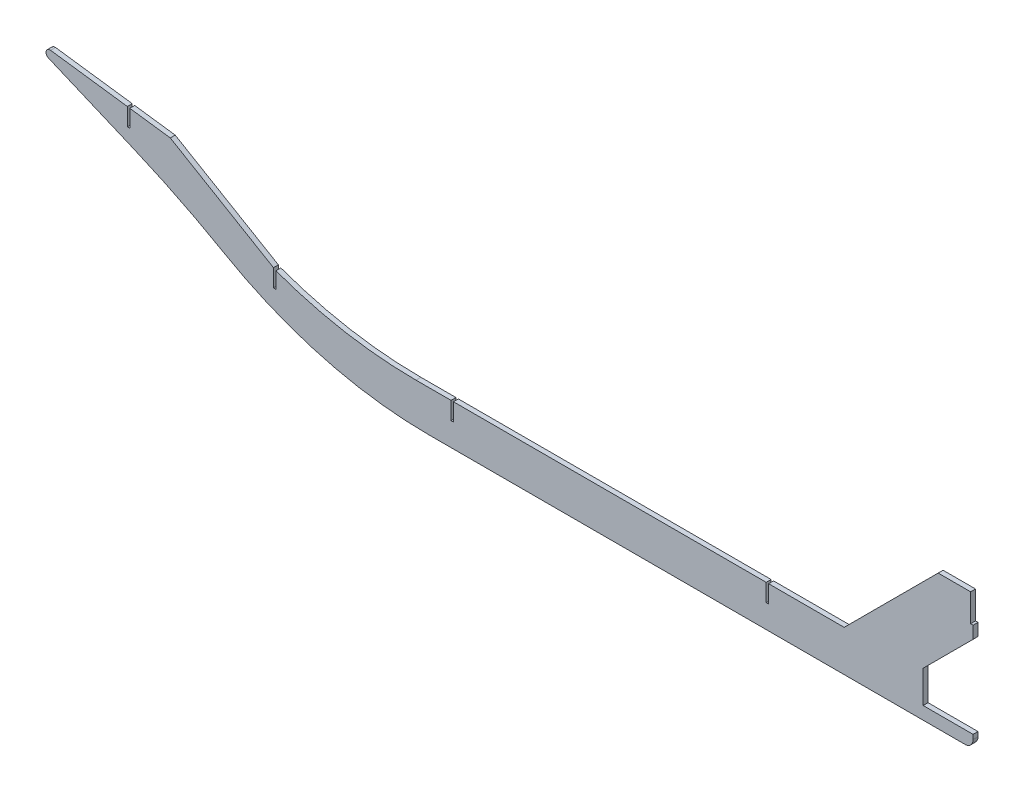
from build123d import *

# Parameters (mm, degrees)
BOSS_EXTRU_1_DEPTH = 6
CONG_1_R           = 1000
CONG_2_R           = 500
CONG_4_R           = 10
CONG_5_R           = 5
CONG_6_R           = 500


with BuildPart() as part:
    # Esquisse2 → Boss.-Extru.1 (new body)
    with BuildSketch(Plane.XY):
        Polygon((0, 0), (-800, 0), (-963.993473565, 96.541430402), (-1163.117471936, 180.636697165), (-1032.508966499, 163.110428865), (-1032.508966499, 141.610428865), (-1029.508966499, 141.610428865), (-1029.508966499, 162.707860864), (-980.08668451, 156.075917781), (-854.092873153, 81.904534581), (-854.092873153, 60.404534581), (-851.092873153, 60.404534581), (-851.092873153, 80.138462524), (-799.897120857, 50), (-637.333486788, 50), (-637.333486788, 28.5), (-634.333486788, 28.5), (-634.333486788, 50), (-252.546237876, 50), (-252.546237876, 28.5), (-249.546237876, 28.5), (-249.546237876, 50), (-157.380204695, 50), (-42.620023216, 164.760181479), (-3, 164.760181479), (-3, 130.978409526), (0, 130.978409526), (0, 115.978409526), (-60.96795982, 55.010449706), (-60.96795982, 15.54862942), (0, 15.54862942), align=None)
    extrude(amount=BOSS_EXTRU_1_DEPTH)

    # Congé1
    cong_1_edges = [part.edges().sort_by_distance(p)[0] for p in [
        (-963.993473565, 96.541430402, 3),
    ]]
    fillet(cong_1_edges, radius=CONG_1_R)

    # Congé2
    cong_2_edges = [part.edges().sort_by_distance(p)[0] for p in [
        (-800, 0, 3),
    ]]
    fillet(cong_2_edges, radius=CONG_2_R)

    # Congé4
    cong_4_edges = [part.edges().sort_by_distance(p)[0] for p in [
        (0, 0, 3),
    ]]
    fillet(cong_4_edges, radius=CONG_4_R)

    # Congé5
    cong_5_edges = [part.edges().sort_by_distance(p)[0] for p in [
        (-1163.117471936, 180.636697165, 3),
    ]]
    fillet(cong_5_edges, radius=CONG_5_R)

    # Congé6
    # the kernel refuses this fillet: 500 mm, written as the material it adds along each edge
    with BuildSketch(Plane(origin=(-799.897120857, 50, 0), x_dir=(-0.8617626627439038, 0.5073116528333809, 0), z_dir=(0, 0, 1))) as cong_6_piece_1_section:
        with BuildLine():
            CenterArc((150.440377281, -491.643304898), CONG_6_R, 100.490027974, 19.994897644)
            Line((-103.215449136, -60.761973526), (-108.288565664, -52.144346898))
            Line((-108.288565664, -52.144346898), (-5.073116528, 8.617626627))
            Line((-5.073116528, 8.617626627), (0, 10))
            ThreePointArc((0, 10), (29.704090529, 10), (57.587537133, 9.832866098))
            Line((57.587537133, 9.832866098), (59.408181057, 0))
        make_face()
    cong_6_piece_1 = extrude(amount=6, mode=Mode.PRIVATE)
    cong_6_piece_1 = split(cong_6_piece_1, bisect_by=Plane(origin=(-851.092873153, 52.596718386, 3), z_dir=(1, 0, 0)), keep=Keep.TOP, mode=Mode.PRIVATE)
    add(cong_6_piece_1)


solid = part.part
